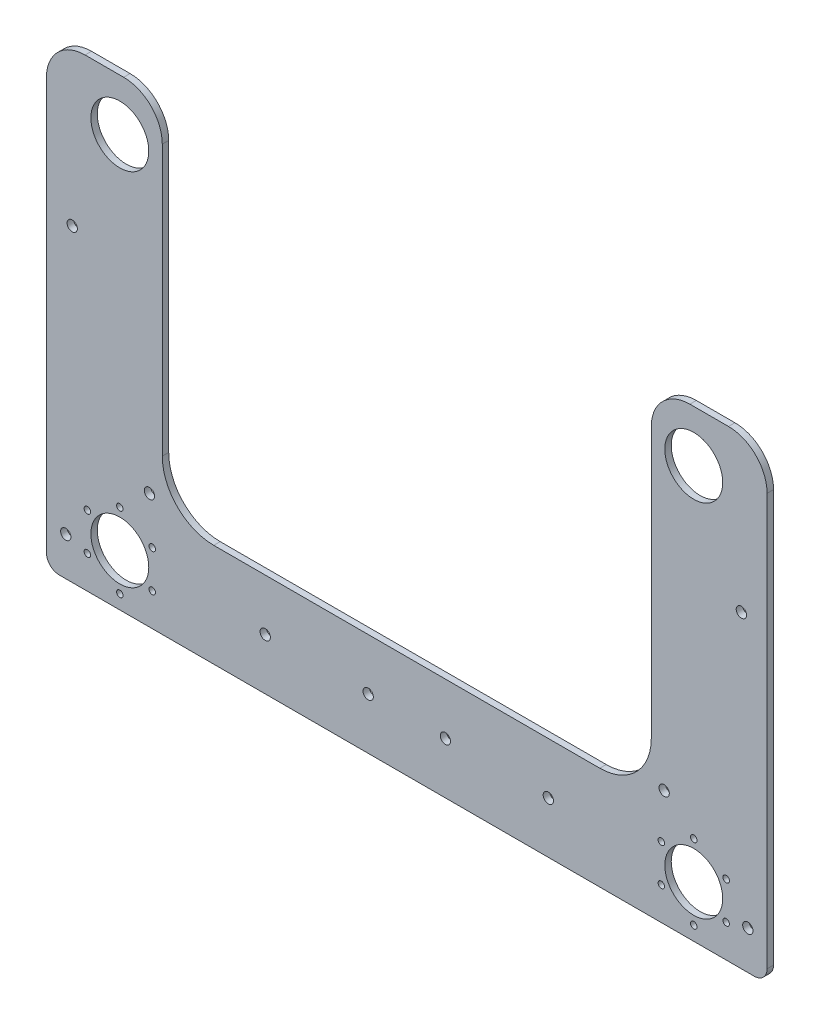
from build123d import *

# Parameters (mm, degrees)
SKETCH1_R           = 14.2875
SKETCH1_R_2         = 1.6002
SKETCH1_R_3         = 2.54
BOSS_EXTRUDE3_DEPTH = 3.175
SKETCH2_W           = 355.6
SKETCH2_H           = 19.05
CUT_EXTRUDE1_DEPTH  = 290.621961572
FILLET1_R           = 19.05


with BuildPart() as part:
    # Sketch1 → Boss-Extrude3 (new body)
    with BuildSketch(Plane.XY):
        with BuildLine():
            Line((120.65, -152.4), (120.65, -6.35))
            Line((120.65, -6.35), (120.65, 6.35))
            ThreePointArc((120.65, 6.35), (124.369743879, 15.330256121), (133.35, 19.05))
            Line((133.35, 19.05), (165.1, 19.05))
            ThreePointArc((165.1, 19.05), (174.080256121, 15.330256121), (177.8, 6.35))
            Line((177.8, 6.35), (177.8, -6.35))
            Line((177.8, -6.35), (177.8, -222.25))
            ThreePointArc((177.8, -222.25), (175.940128061, -226.740128061), (171.45, -228.6))
            Line((171.45, -228.6), (12.7, -228.6))
            Line((12.7, -228.6), (-12.7, -228.6))
            Line((-12.7, -228.6), (-171.45, -228.6))
            ThreePointArc((-171.45, -228.6), (-175.940128061, -226.740128061), (-177.8, -222.25))
            Line((-177.8, -222.25), (-177.8, -6.35))
            Line((-177.8, -6.35), (-177.8, 6.35))
            ThreePointArc((-177.8, 6.35), (-174.080256121, 15.330256121), (-165.1, 19.05))
            Line((-165.1, 19.05), (-133.35, 19.05))
            ThreePointArc((-133.35, 19.05), (-124.369743879, 15.330256121), (-120.65, 6.35))
            Line((-120.65, 6.35), (-120.65, -6.35))
            Line((-120.65, -6.35), (-120.65, -152.4))
            ThreePointArc((-120.65, -152.4), (-113.210512242, -170.360512242), (-95.25, -177.8))
            Line((-95.25, -177.8), (-12.7, -177.8))
            Line((-12.7, -177.8), (12.7, -177.8))
            Line((12.7, -177.8), (95.25, -177.8))
            ThreePointArc((95.25, -177.8), (113.210512242, -170.360512242), (120.65, -152.4))
        make_face()
        with Locations((141.605, -25.4)):
            Circle(SKETCH1_R, mode=Mode.SUBTRACT)
        with Locations((-141.605, -25.4)):
            Circle(SKETCH1_R, mode=Mode.SUBTRACT)
        with Locations((-141.605, -203.2)):
            Circle(SKETCH1_R, mode=Mode.SUBTRACT)
        with Locations((-141.605, -184.722481985)):
            Circle(SKETCH1_R_2, mode=Mode.SUBTRACT)
        with Locations((-125.603, -193.961240992)):
            Circle(SKETCH1_R_2, mode=Mode.SUBTRACT)
        with Locations((-125.603, -212.438759008)):
            Circle(SKETCH1_R_2, mode=Mode.SUBTRACT)
        with Locations((-141.605, -221.677518015)):
            Circle(SKETCH1_R_2, mode=Mode.SUBTRACT)
        with Locations((-157.607, -212.438759008)):
            Circle(SKETCH1_R_2, mode=Mode.SUBTRACT)
        with Locations((-157.607, -193.961240992)):
            Circle(SKETCH1_R_2, mode=Mode.SUBTRACT)
        with Locations((157.607, -212.438759008)):
            Circle(SKETCH1_R_2, mode=Mode.SUBTRACT)
        with Locations((157.607, -193.961240992)):
            Circle(SKETCH1_R_2, mode=Mode.SUBTRACT)
        with Locations((141.605, -184.722481985)):
            Circle(SKETCH1_R_2, mode=Mode.SUBTRACT)
        with Locations((125.603, -193.961240992)):
            Circle(SKETCH1_R_2, mode=Mode.SUBTRACT)
        with Locations((125.603, -212.438759008)):
            Circle(SKETCH1_R_2, mode=Mode.SUBTRACT)
        with Locations((141.605, -221.677518015)):
            Circle(SKETCH1_R_2, mode=Mode.SUBTRACT)
        with Locations((141.605, -203.2)):
            Circle(SKETCH1_R, mode=Mode.SUBTRACT)
        with Locations((-69.85, -203.2)):
            Circle(SKETCH1_R_3, mode=Mode.SUBTRACT)
        with Locations((69.85, -203.2)):
            Circle(SKETCH1_R_3, mode=Mode.SUBTRACT)
        with Locations((-19.05, -203.2)):
            Circle(SKETCH1_R_3, mode=Mode.SUBTRACT)
        with Locations((-127, -171.45)):
            Circle(SKETCH1_R_3, mode=Mode.SUBTRACT)
        with Locations((-149.225, 6.35)):
            Circle(SKETCH1_R_3, mode=Mode.SUBTRACT)
        with Locations((127, -171.45)):
            Circle(SKETCH1_R_3, mode=Mode.SUBTRACT)
        with Locations((149.225, 6.35)):
            Circle(SKETCH1_R_3, mode=Mode.SUBTRACT)
        with Locations((-168.275, -209.55)):
            Circle(SKETCH1_R_3, mode=Mode.SUBTRACT)
        with Locations((168.275, -209.55)):
            Circle(SKETCH1_R_3, mode=Mode.SUBTRACT)
        with Locations((-165.1, -76.2)):
            Circle(SKETCH1_R_3, mode=Mode.SUBTRACT)
        with Locations((165.1, -76.2)):
            Circle(SKETCH1_R_3, mode=Mode.SUBTRACT)
        with Locations((19.05, -203.2)):
            Circle(SKETCH1_R_3, mode=Mode.SUBTRACT)
    extrude(amount=BOSS_EXTRUDE3_DEPTH)

    # Sketch2 → Cut-Extrude1 (cut, through all)
    with BuildSketch(Plane.XY.offset(3.175)):
        with Locations((0, 9.525)):
            Rectangle(SKETCH2_W, SKETCH2_H)
    extrude(amount=-CUT_EXTRUDE1_DEPTH, mode=Mode.SUBTRACT)

    # Fillet1
    fillet1_edges = [part.edges().sort_by_distance(p)[0] for p in [
        (177.8, 0, 1.5875),
        (120.65, 0, 1.5875),
        (-120.65, 0, 1.5875),
        (-177.8, 0, 1.5875),
    ]]
    fillet(fillet1_edges, radius=FILLET1_R)


solid = part.part
